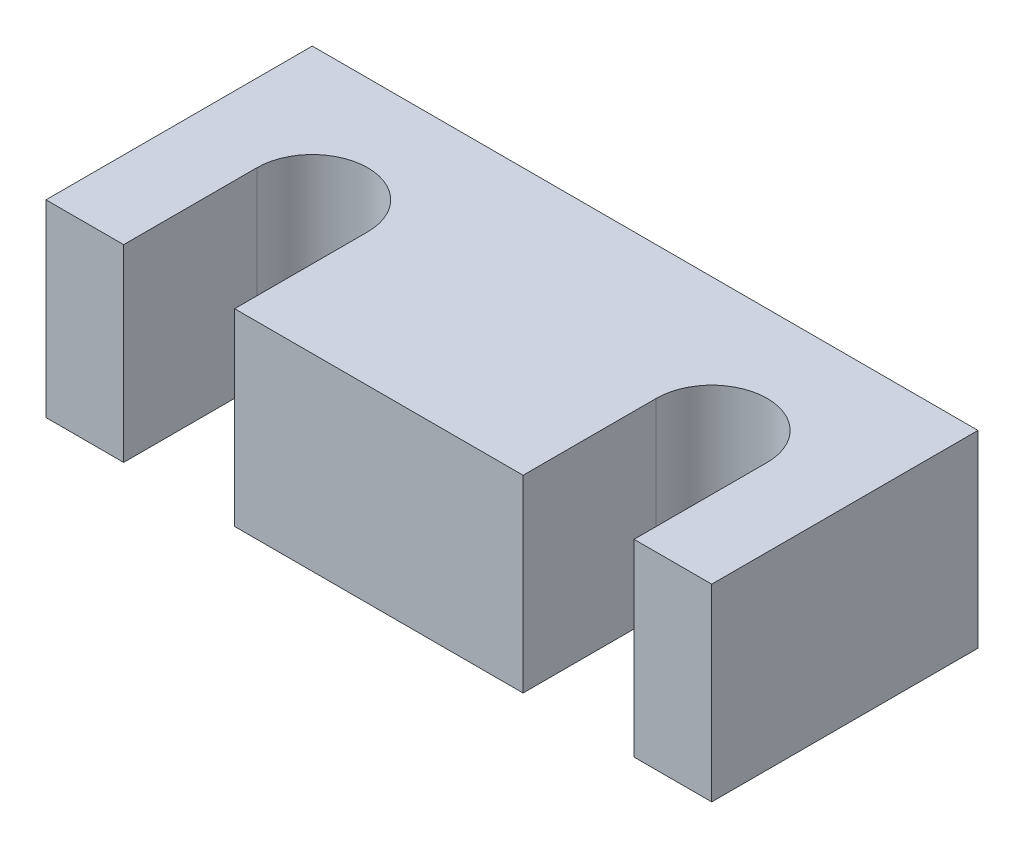
from build123d import *

# Parameters (mm, degrees)
SKETCH1_W           = 30
SKETCH1_H           = 12
BOSS_EXTRUDE1_DEPTH = 8.5
SKETCH2_R           = 1.5
CUT_EXTRUDE1_DEPTH  = 19.255136264
CUT_EXTRUDE2_DEPTH  = 19.255136264
BOSS_EXTRUDE2_DEPTH = 2


with BuildPart() as part:
    # Sketch1 → Boss-Extrude1 (new body)
    with BuildSketch(Plane(origin=(0, 0, 0), x_dir=(1, 0, 0), z_dir=(0, 1, 0))):
        Rectangle(SKETCH1_W, SKETCH1_H)
    extrude(amount=BOSS_EXTRUDE1_DEPTH)

    # Sketch2 → Cut-Extrude1 (cut, through all)
    with BuildSketch(Plane(origin=(0, 8.5, 0), x_dir=(1, 0, 0), z_dir=(0, 1, 0))):
        with Locations((-9, 0)):
            Circle(SKETCH2_R)
        with Locations((9, 0)):
            Circle(SKETCH2_R)
    extrude(amount=-CUT_EXTRUDE1_DEPTH, mode=Mode.SUBTRACT)

    # Sketch3 → Cut-Extrude2 (cut, through all)
    with BuildSketch(Plane(origin=(0, 8.5, 0), x_dir=(1, 0, 0), z_dir=(0, 1, 0))):
        with BuildLine():
            Line((-6.5, 0), (-6.5, -6))
            ThreePointArc((-6.5, -6), (-9, -8.5), (-11.5, -6))
            Line((-11.5, -6), (-11.5, 0))
            ThreePointArc((-11.5, 0), (-9, 2.5), (-6.5, 0))
        make_face()
        with BuildLine():
            Line((11.5, 0), (11.5, -6))
            ThreePointArc((11.5, -6), (9, -8.5), (6.5, -6))
            Line((6.5, -6), (6.5, 0))
            ThreePointArc((6.5, 0), (9, 2.5), (11.5, 0))
        make_face()
    extrude(amount=-CUT_EXTRUDE2_DEPTH, mode=Mode.SUBTRACT)

    # Sketch4 → Boss-Extrude2 (add)
    with BuildSketch(Plane.XZ):
        with BuildLine():
            Line((-6, -6), (-6, 0))
            ThreePointArc((-6, 0), (0, 6), (6, 0))
            Line((6, 0), (6, -6))
            ThreePointArc((6, -6), (0, -12), (-6, -6))
        make_face()
    extrude(amount=-BOSS_EXTRUDE2_DEPTH)


solid = part.part
